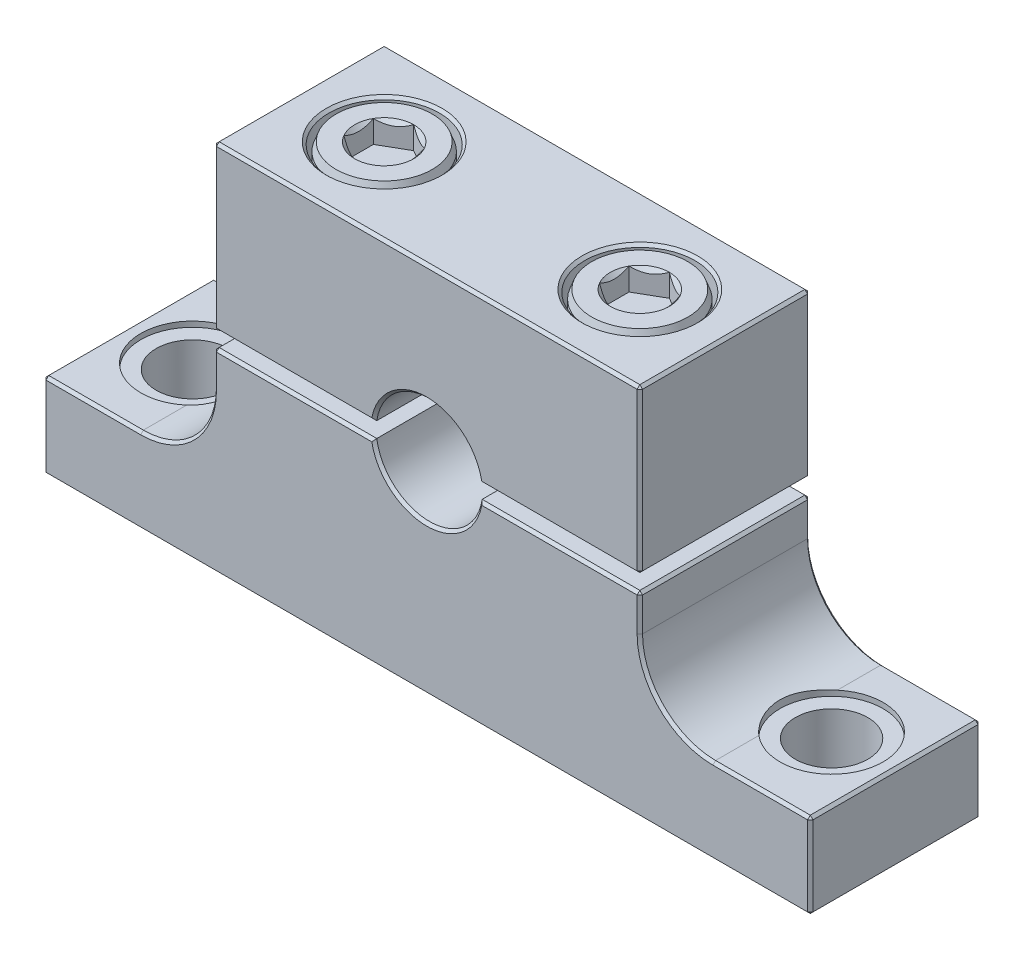
from build123d import *

# Parameters (mm, degrees)
BOSS_EXTRUDE1_DEPTH        = 4
BOSS_EXTRUDE1_DEPTH_BACK   = 4
BOSS_EXTRUDE1_2_DEPTH      = 4
BOSS_EXTRUDE1_2_DEPTH_BACK = 4
SKETCH4_R                  = 1.7
CUT_EXTRUDE1_DEPTH         = 26.421447638
SKETCH8_R                  = 2.421
CUT_EXTRUDE3_DEPTH         = 5.392
SKETCH10_R                 = 1.754
CUT_EXTRUDE4_DEPTH         = 26.421447654
SKETCH12_R                 = 2.592
CUT_EXTRUDE5_DEPTH         = 3.215
CHAMFER4_SIZE              = 0.144
CHAMFER4_SIZE2             = 0.395636748
CUT_EXTRUDE6_DEPTH         = 1.056
SKETCH20_R                 = 1.385640646
CUT_EXTRUDE7_DEPTH         = 1.056
CUT_EXTRUDE7_DRAFT         = -45
CHAMFER2_SIZE              = 0.127
CHAMFER3_SIZE              = 0.127
CHAMFER5_SIZE              = 0.3
CUT_SWEEP1_PITCH           = 0.5
CUT_SWEEP1_TO              = 7.3
CIRPATTERN1_COUNT          = 2


with BuildPart() as part:
    # Sketch3 → Boss-Extrude1 (new, two sides: drawn at the far end of the back side and taken through both)
    with BuildSketch(Plane.XY.offset(-BOSS_EXTRUDE1_DEPTH_BACK)):
        with BuildLine():
            Line((-10, 8.75), (10, 8.75))
            Line((10, 8.75), (10, 1.112))
            Line((10, 1.112), (2.47365236, 1.112))
            ThreePointArc((2.47365236, 1.112), (0, 3.25), (-2.47365236, 1.112))
            Line((-2.47365236, 1.112), (-10, 1.112))
            Line((-10, 1.112), (-10, 8.75))
        make_face()
    extrude(amount=BOSS_EXTRUDE1_DEPTH + BOSS_EXTRUDE1_DEPTH_BACK)


with BuildPart() as body_2:
    # Sketch3 → Boss-Extrude1 2 (new, two sides: drawn at the far end of the back side and taken through both)
    with BuildSketch(Plane.XY.offset(-BOSS_EXTRUDE1_2_DEPTH_BACK)):
        with BuildLine():
            Line((-10, 0.388), (-10, -1.321))
            ThreePointArc((-10, -1.321), (-11.004330847, -3.745669153), (-13.429, -4.75))
            Line((-13.429, -4.75), (-18, -4.75))
            Line((-18, -4.75), (-18, -8.75))
            Line((-18, -8.75), (18, -8.75))
            Line((18, -8.75), (18, -4.75))
            Line((18, -4.75), (13.429, -4.75))
            ThreePointArc((13.429, -4.75), (11.004330847, -3.745669153), (10, -1.321))
            Line((10, -1.321), (10, 0.388))
            Line((10, 0.388), (2.47365236, 0.388))
            ThreePointArc((2.47365236, 0.388), (0, -1.75), (-2.47365236, 0.388))
            Line((-2.47365236, 0.388), (-10, 0.388))
        make_face()
    extrude(amount=BOSS_EXTRUDE1_2_DEPTH + BOSS_EXTRUDE1_2_DEPTH_BACK)

    # Sketch4 → Cut-Extrude1 (cut, through all)
    with BuildSketch(Plane.XZ.offset(8.75)):
        with Locations((-15, 0)):
            Circle(SKETCH4_R)
        with Locations(Location((15, 0, 0), (0, 0, 202.464322418))):
            Circle(SKETCH4_R)
    extrude(amount=-CUT_EXTRUDE1_DEPTH, mode=Mode.SUBTRACT)

    # Sketch8 → Cut-Extrude3 (cut)
    with BuildSketch(Plane(origin=(0, 0.388, 0), x_dir=(1, 0, 0), z_dir=(0, 1, 0))):
        with Locations(Location((-15, 0, 0), (0, 0, 180))):
            Circle(SKETCH8_R)
        with Locations(Location((15, 0, 0), (0, 0, 180))):
            Circle(SKETCH8_R)
    extrude(amount=-CUT_EXTRUDE3_DEPTH, mode=Mode.SUBTRACT)


with BuildPart() as cut_extrude4_tool:
    # Sketch10 → Cut-Extrude4 (new, through all)
    with BuildSketch(Plane(origin=(0, 8.75, 0), x_dir=(1, 0, 0), z_dir=(0, 1, 0))):
        with Locations(Location((6, 0, 0), (0, 0, 180))):
            Circle(SKETCH10_R)
        with Locations(Location((-6, 0, 0), (0, 0, 180))):
            Circle(SKETCH10_R)
    extrude(amount=-CUT_EXTRUDE4_DEPTH)


with BuildPart() as part_1:
    add(part.part)

    # Cut-Extrude4: cut by cut_extrude4_tool
    add(cut_extrude4_tool.part, mode=Mode.SUBTRACT)

    # Sketch12 → Cut-Extrude5 (cut)
    with BuildSketch(Plane(origin=(0, 8.75, 0), x_dir=(1, 0, 0), z_dir=(0, 1, 0))):
        with Locations((6, 0)):
            Circle(SKETCH12_R)
        with Locations(Location((-6, 0, 0), (0, 0, 180))):
            Circle(SKETCH12_R)
    extrude(amount=-CUT_EXTRUDE5_DEPTH, mode=Mode.SUBTRACT)

    # Chamfer2
    chamfer2_edges = [part_1.edges().sort_by_distance(p)[0] for p in [
        (0, 3.25, -4),
        (-10, 8.75, 0),
        (10, 8.75, 0),
        (10, 1.112, 0),
        (6.23682618, 1.112, -4),
        (10, 4.931, -4),
        (-10, 4.931, 4),
        (-6.23682618, 1.112, 4),
        (0, 3.25, 4),
        (6.23682618, 1.112, 4),
        (10, 4.931, 4),
        (0, 8.75, -4),
        (0, 8.75, 4),
        (-10, 4.931, -4),
        (3.408, 8.75, 0),
        (-3.408, 8.75, 0),
        (-6.23682618, 1.112, -4),
    ]]
    chamfer(chamfer2_edges, length=CHAMFER2_SIZE)


with BuildPart() as body_2_1:
    add(body_2.part)

    # Cut-Extrude4: cut by cut_extrude4_tool
    add(cut_extrude4_tool.part, mode=Mode.SUBTRACT)

    # Chamfer3
    chamfer3_edges = [body_2_1.edges().sort_by_distance(p)[0] for p in [
        (-11.004330847, -3.745669153, -4),
        (-15.7145, -4.75, -4),
        (-18, -6.75, -4),
        (0, -8.75, -4),
        (10, 0.388, 0),
        (18, -4.75, 0),
        (18, -8.75, 0),
        (-18, -8.75, 0),
        (-18, -4.75, 0),
        (-10, 0.388, 0),
        (18, -6.75, -4),
        (15.7145, -4.75, -4),
        (11.004330847, -3.745669153, -4),
        (10, -0.4665, -4),
        (-6.23682618, 0.388, 4),
        (-10, -0.4665, 4),
        (-11.004330847, -3.745669153, 4),
        (6.23682618, 0.388, -4),
        (-15.7145, -4.75, 4),
        (-18, -6.75, 4),
        (0, -8.75, 4),
        (18, -6.75, 4),
        (15.7145, -4.75, 4),
        (11.004330847, -3.745669153, 4),
        (10, -0.4665, 4),
        (6.23682618, 0.388, 4),
        (0, -1.75, 4),
        (0, -1.75, -4),
        (-6.23682618, 0.388, -4),
        (-10, -0.4665, -4),
    ]]
    chamfer(chamfer3_edges, length=CHAMFER3_SIZE)


with BuildPart() as body_3:
    # Sketch15 → Revolve1 (revolve)
    with BuildSketch(Plane.XY, mode=Mode.PRIVATE) as revolve1_sk:
        Polygon((-6, -1.75), (-6, 8.75), (-8.4, 8.75), (-8.4, 5.55), (-7.5, 5.55), (-7.5, -1.75), align=None)
    revolve(revolve1_sk.sketch.rotate(Axis((-6, -1.75, 0), (0, 1, 0)), 270), axis=Axis((-6, -1.75, 0), (0, 1, 0)))

    # Chamfer4
    chamfer4_edges = [body_3.edges().sort_by_distance(p)[0] for p in [
        (-6, 8.75, 2.4),
    ]]
    chamfer4_side = [body_3.faces().sort_by_distance(p)[0] for p in [
        (-6, 8.75, 0),
    ]]
    chamfer(chamfer4_edges, length=CHAMFER4_SIZE, length2=CHAMFER4_SIZE2, reference=chamfer4_side[0])

    # Sketch16 → Cut-Extrude6 (cut)
    with BuildSketch(Plane(origin=(0, 8.75, 0), x_dir=(1, 0, 0), z_dir=(0, 1, 0))):
        Polygon((-6, 1.385640646), (-7.2, 0.692820323), (-7.2, -0.692820323), (-6, -1.385640646), (-4.8, -0.692820323), (-4.8, 0.692820323), align=None)
    extrude(amount=-CUT_EXTRUDE6_DEPTH, mode=Mode.SUBTRACT)


with BuildPart() as cut_extrude7_tool:
    # Sketch20 → Cut-Extrude7 (with draft: the straight prism first)
    with BuildSketch(Plane(origin=(0, 8.75, 0), x_dir=(1, 0, 0), z_dir=(0, 1, 0))):
        with Locations((-6, 0)):
            Circle(SKETCH20_R)
    extrude(amount=-CUT_EXTRUDE7_DEPTH)
    # Cut-Extrude7: the draft: its side faces are tilted about the plane it starts from
    cut_extrude7_sides = [cut_extrude7_tool.faces().sort_by_distance(p)[0] for p in [
        (-7.385640646, 8.222, 0),
    ]]
    draft(cut_extrude7_sides, Plane(origin=(0, 8.75, 0), x_dir=(1, 0, 0), z_dir=(0, 1, 0)), CUT_EXTRUDE7_DRAFT)


with BuildPart() as body_3_1:
    add(body_3.part)

    # Cut-Extrude7: cut by cut_extrude7_tool
    add(cut_extrude7_tool.part, mode=Mode.SUBTRACT)


with BuildPart() as body_4:
    # Mirror1: mirrored copy
    add(body_3_1.part.mirror(Plane(origin=(0, 0, 0), x_dir=(0, 0, 1), z_dir=(1, 0, 0))))

    # Chamfer5
    chamfer5_edges = [body_4.edges().sort_by_distance(p)[0] for p in [
        (6, -1.75, 1.5),
    ]]
    chamfer(chamfer5_edges, length=CHAMFER5_SIZE)


with BuildPart() as body_5:
    # Split1: read off the stored shape, not the designer's step
    # Split1: the piece on the far side of the plane
    add(body_4.part)
    split(bisect_by=Plane(origin=(0, 5.55, 0), x_dir=(1, 0, 0), z_dir=(0, 1, 0)), keep=Keep.BOTTOM)

    # Cut-Sweep1: arcs per turn and ends read off the stored shape
    # Cut-Sweep1: the profile of Sketch21 screwed along a right-hand helix through 15.6 turns, 6 arcs to a turn; built about Z, then put on its axis
    cut_sweep1_z = Axis((0, 0, 0), (0, 0, 1))
    cut_sweep1_corners = [(1.175240474, 0, 0.1125), (1.527063294, 0, 0.315625), (1.527063294, 0, -0.153125), (1.175240474, 0, 0.05)]
    with BuildLine(mode=Mode.PRIVATE) as cut_sweep1_profile:
        Line(cut_sweep1_corners[0], cut_sweep1_corners[1])
        Line(cut_sweep1_corners[1], cut_sweep1_corners[2])
        Line(cut_sweep1_corners[2], cut_sweep1_corners[3])
        Line(cut_sweep1_corners[3], cut_sweep1_corners[0])
    cut_sweep1_cap = Face(cut_sweep1_profile.wire())
    cut_sweep1_turn_angles = [0, 30, 60, 90, 120, 150, 180, 210, 240, 270, 300, 330, 360]
    cut_sweep1_turn_weights = [1, 0.8660254037844387, 1, 0.8660254037844387, 1, 0.8660254037844387, 1, 0.8660254037844387, 1, 0.8660254037844387, 1, 0.8660254037844387, 1]
    cut_sweep1_turn_rails = [Edge.make_bspline([Vector(p[0], p[1], 0).rotate(cut_sweep1_z, cut_sweep1_turn_angles[k]) / cut_sweep1_turn_weights[k] + Vector(0, 0, p[2] + CUT_SWEEP1_PITCH * cut_sweep1_turn_angles[k] / 360) for k in range(13)], [0, 0, 0, 1, 1, 2, 2, 3, 3, 4, 4, 5, 5, 6, 6, 6], 2, cut_sweep1_turn_weights) for p in cut_sweep1_corners]
    cut_sweep1_turn_sides = [Face.make_surface_from_curves(cut_sweep1_turn_rails[p[0]], cut_sweep1_turn_rails[p[1]]) for p in [(0, 1), (1, 2), (2, 3), (3, 0)]]
    cut_sweep1_last_angles = [5400, 5430, 5460, 5490, 5520, 5550, 5580, 5598, 5616]
    cut_sweep1_last_weights = [1, 0.8660254037844387, 1, 0.8660254037844387, 1, 0.8660254037844387, 1, 0.9510565162950604, 1]
    cut_sweep1_last_rails = [Edge.make_bspline([Vector(p[0], p[1], 0).rotate(cut_sweep1_z, cut_sweep1_last_angles[k]) / cut_sweep1_last_weights[k] + Vector(0, 0, p[2] + CUT_SWEEP1_PITCH * cut_sweep1_last_angles[k] / 360) for k in range(9)], [0, 0, 0, 1, 1, 2, 2, 3, 3, 4, 4, 4], 2, cut_sweep1_last_weights) for p in cut_sweep1_corners]
    cut_sweep1_last_sides = [Face.make_surface_from_curves(cut_sweep1_last_rails[p[0]], cut_sweep1_last_rails[p[1]]) for p in [(0, 1), (1, 2), (2, 3), (3, 0)]]
    cut_sweep1 = Plane(origin=(6, -1.75, 0), x_dir=(1, 0, 0), z_dir=(0, 1, 0)) * split(Solid(Shell([*[p.moved(Location((0, 0, CUT_SWEEP1_PITCH * i))) for i in range(15) for p in cut_sweep1_turn_sides], *cut_sweep1_last_sides, cut_sweep1_cap, cut_sweep1_cap.rotate(cut_sweep1_z, 5616).moved(Location((0, 0, CUT_SWEEP1_PITCH * 5616 / 360)))])), bisect_by=Plane.XY.offset(CUT_SWEEP1_TO), keep=Keep.BOTTOM, mode=Mode.PRIVATE)
    add(cut_sweep1, mode=Mode.SUBTRACT)


with BuildPart() as body_4_1:
    add(body_4.part)

    # Split1
    split(bisect_by=Plane(origin=(0, 5.55, 0), x_dir=(1, 0, 0), z_dir=(0, 1, 0)), keep=Keep.TOP)

    add(body_5.part)  # Boss-Extrude2 merges body 5
    # Boss-Extrude2: read off the stored shape, not the designer's step
    # Boss-Extrude2 outline → Boss-Extrude2 (revolve)
    with BuildSketch(Plane(origin=(6, 0, 0), x_dir=(1, 0, 0), z_dir=(0, 0, 1))):
        Polygon((1.175236469, 5.55), (1.175236469, 5.171109881), (1.554126588, 5.55), align=None)
    revolve(axis=Axis((6, 0, 0), (0, 1, 0)))


with BuildPart() as cirpattern1_1:
    # CirPattern1: pattern copy
    add(body_4_1.part.rotate(Axis((0, 8.75, 0), (0, -1, 0)), 1 * 360 / CIRPATTERN1_COUNT))


solid = Compound([part_1.part, body_2_1.part, body_4_1.part, cirpattern1_1.part])
